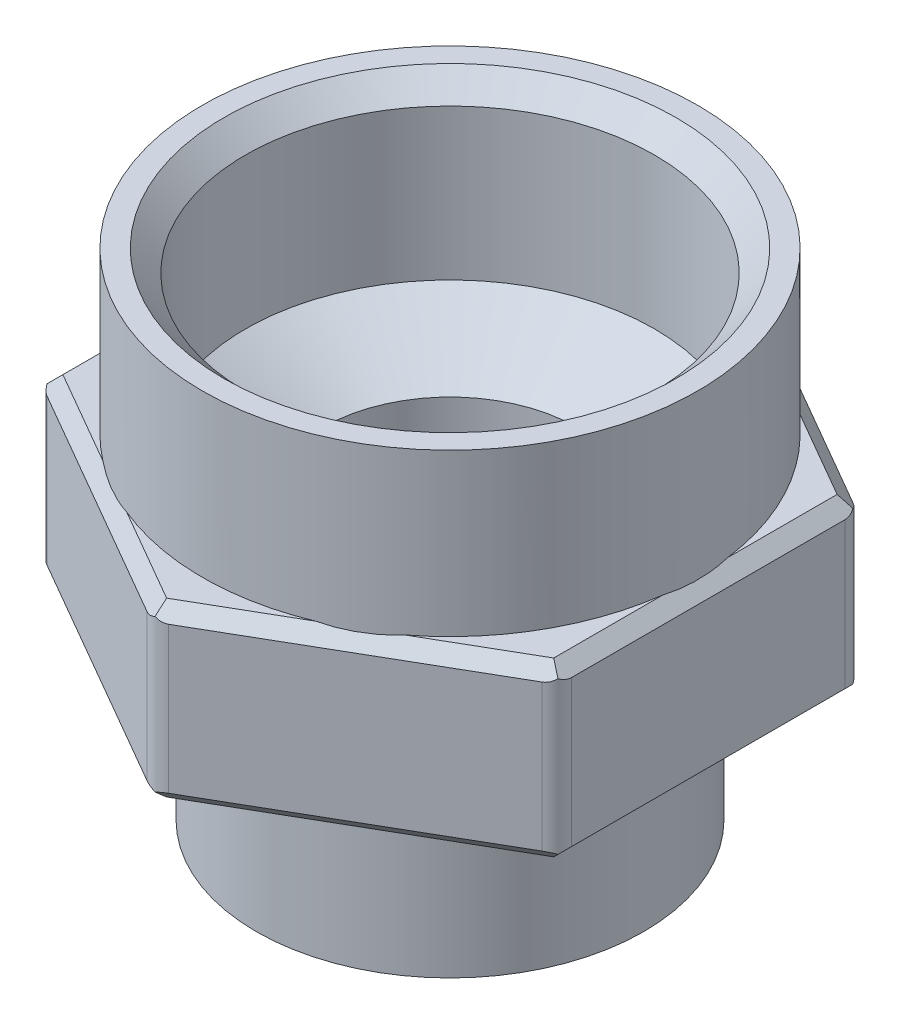
from build123d import *

# Parameters (mm, degrees)
SKETCH_1_R                    = 9
EXTRUDE_1_DEPTH               = 7.5
EXTRUDE_2_DEPTH               = 8
SKETCH_3_R                    = 11.5
EXTRUDE_3_DEPTH               = 7.5
CHAMFER_2_SIZE                = 0.6
FILLET_1_R                    = 1
HOLE_WIZARD_G1_22_D           = 19
HOLE_WIZARD_G1_22_DEPTH       = 8
HOLE_WIZARD_G1_22_CSINK_D     = 21.005
HOLE_WIZARD_G1_22_CSINK_ANGLE = 90
HOLE_WIZARD_G1_22_TIP         = 5.708175880761822
HOLE_WIZARD_G1_41_D           = 11.8
HOLE_WIZARD_G1_41_DEPTH       = 30.32
HOLE_WIZARD_G1_41_CSINK_D     = 13.207
HOLE_WIZARD_G1_41_CSINK_ANGLE = 90
HOLE_WIZARD_G1_41_TIP         = 3.5450776522626057


with BuildPart() as part:
    # Эскиз1 → Бобышка-Вытянуть1 (new body)
    with BuildSketch(Plane(origin=(0, 0, 0), x_dir=(1, 0, 0), z_dir=(0, 1, 0))):
        with Locations(Location((0, 0, 0), (0, 0, 270))):
            Circle(SKETCH_1_R)
    extrude(amount=EXTRUDE_1_DEPTH)

    # Эскиз2 → Бобышка-Вытянуть2 (add)
    with BuildSketch(Plane(origin=(0, 7.5, 0), x_dir=(1, 0, 0), z_dir=(0, 1, 0))):
        Polygon((-3.47e-15, 13.856406460551018), (-12, 6.92820323027551), (-11.999999999999996, -6.9282032302755105), (1.63e-15, -13.856406460551016), (12, -6.928203230275508), (11.999999999999993, 6.928203230275516), align=None)
    extrude(amount=EXTRUDE_2_DEPTH)

    # Эскиз3 → Бобышка-Вытянуть3 (add)
    with BuildSketch(Plane(origin=(0, 15.5, 0), x_dir=(1, 0, 0), z_dir=(0, 1, 0))):
        with Locations(Location((0, 0, 0), (0, 0, 270))):
            Circle(SKETCH_3_R)
    extrude(amount=EXTRUDE_3_DEPTH)

    # Фаска2
    # the kernel refuses this chamfer: 0.6 mm, written as the material it takes off along each edge
    with BuildSketch(Plane(origin=(13.336285678835246, 7.5, -6.156698333885741), x_dir=(0.01374793830529287, 0.9996219169112968, -0.023812127644089635), z_dir=(-0.8660254037844389, 0, -0.4999999999999997))) as chamfer_2_piece_1:
        Polygon((CHAMFER_2_SIZE * 0.999621916911, -CHAMFER_2_SIZE * 0.0274958766106), (-CHAMFER_2_SIZE * 0.0274958766106, -CHAMFER_2_SIZE * 0.999621916911), (0, 0), align=None)
    extrude(amount=16.942426046110114, mode=Mode.SUBTRACT)
    with BuildSketch(Plane(origin=(1.3362856788352484, 7.5, -14.627911356940793), x_dir=(-0.013747938305293587, 0.9996219169112968, -0.023812127644090856), z_dir=(-0.8660254037844387, 0, 0.5000000000000001))) as chamfer_2_piece_2:
        Polygon((CHAMFER_2_SIZE * 0.999621916911, -CHAMFER_2_SIZE * 0.0274958766106), (-CHAMFER_2_SIZE * 0.0274958766106, -CHAMFER_2_SIZE * 0.999621916911), (0, 0), align=None)
    extrude(amount=16.942426046110114, mode=Mode.SUBTRACT)
    with BuildSketch(Plane(origin=(-12, 7.5, -8.471213023055057), x_dir=(-0.027495876610587344, 0.9996219169112968, 0), z_dir=(2.6e-16, 0, 1))) as chamfer_2_piece_3:
        Polygon((CHAMFER_2_SIZE * 0.999621916911, -CHAMFER_2_SIZE * 0.0274958766106), (-CHAMFER_2_SIZE * 0.0274958766106, -CHAMFER_2_SIZE * 0.999621916911), (0, 0), align=None)
    extrude(amount=16.942426046110118, mode=Mode.SUBTRACT)
    with BuildSketch(Plane(origin=(-13.33628567883525, 7.5, 6.1566983338857355), x_dir=(0.4998109584556482, -0.027495876610585928, -0.8656979742248805), z_dir=(0.8660254037844387, 0, 0.49999999999999983))) as chamfer_2_piece_4:
        Polygon((CHAMFER_2_SIZE * 0.999621916911, CHAMFER_2_SIZE * 0.0274958766106), (-CHAMFER_2_SIZE * 0.0274958766106, CHAMFER_2_SIZE * 0.999621916911), (0, 0), align=None)
    extrude(amount=16.942426046110118, mode=Mode.SUBTRACT)
    with BuildSketch(Plane(origin=(-1.3362856788352513, 7.5, 14.62791135694079), x_dir=(-0.49981095845564827, -0.027495876610585855, -0.8656979742248804), z_dir=(0.8660254037844387, 0, -0.5))) as chamfer_2_piece_5:
        Polygon((CHAMFER_2_SIZE * 0.999621916911, CHAMFER_2_SIZE * 0.0274958766106), (-CHAMFER_2_SIZE * 0.0274958766106, CHAMFER_2_SIZE * 0.999621916911), (0, 0), align=None)
    extrude(amount=16.942426046110114, mode=Mode.SUBTRACT)
    with BuildSketch(Plane(origin=(12, 7.5, 8.471213023055055), x_dir=(-0.9996219169112968, -0.027495876610585904, 0), z_dir=(-5.1e-16, 0, -1))) as chamfer_2_piece_6:
        Polygon((CHAMFER_2_SIZE * 0.999621916911, CHAMFER_2_SIZE * 0.0274958766106), (-CHAMFER_2_SIZE * 0.0274958766106, CHAMFER_2_SIZE * 0.999621916911), (0, 0), align=None)
    extrude(amount=16.94242604611012, mode=Mode.SUBTRACT)
    with BuildSketch(Plane(origin=(13.336285678835246, 15.5, -6.156698333885741), x_dir=(0.01374793830529287, -0.9996219169112968, -0.023812127644089635), z_dir=(-0.8660254037844389, 0, -0.4999999999999997))) as chamfer_2_piece_7_section:
        Polygon((CHAMFER_2_SIZE * 0.999621916911, CHAMFER_2_SIZE * 0.0274958766106), (-CHAMFER_2_SIZE * 0.0274958766106, CHAMFER_2_SIZE * 0.999621916911), (0, 0), align=None)
    chamfer_2_piece_7 = extrude(amount=16.942426046110114, mode=Mode.PRIVATE)
    chamfer_2_piece_7 = chamfer_2_piece_7 - Plane(origin=(0, 15.301333740559118, 0), x_dir=(-1.8e-16, 0, 1), z_dir=(0, -1, 0)) * Cylinder(11.5, 37, mode=Mode.PRIVATE)
    add(chamfer_2_piece_7, mode=Mode.SUBTRACT)
    with BuildSketch(Plane(origin=(1.3362856788352486, 15.5, -14.627911356940793), x_dir=(-0.013747938305293677, -0.9996219169112968, -0.02381212764409101), z_dir=(-0.8660254037844387, 0, 0.5000000000000001))) as chamfer_2_piece_8_section:
        Polygon((CHAMFER_2_SIZE * 0.999621916911, CHAMFER_2_SIZE * 0.0274958766106), (-CHAMFER_2_SIZE * 0.0274958766106, CHAMFER_2_SIZE * 0.999621916911), (0, 0), align=None)
    chamfer_2_piece_8 = extrude(amount=16.942426046110118, mode=Mode.PRIVATE)
    chamfer_2_piece_8 = chamfer_2_piece_8 - Plane(origin=(0, 15.30133374055918, 0), x_dir=(-1.8e-16, 0, 1), z_dir=(0, -1, 0)) * Cylinder(11.5, 37, mode=Mode.PRIVATE)
    add(chamfer_2_piece_8, mode=Mode.SUBTRACT)
    with BuildSketch(Plane(origin=(-12, 15.5, -8.471213023055057), x_dir=(-0.027495876610587344, -0.9996219169112968, 0), z_dir=(2.6e-16, 0, 1))) as chamfer_2_piece_9_section:
        Polygon((CHAMFER_2_SIZE * 0.999621916911, CHAMFER_2_SIZE * 0.0274958766106), (-CHAMFER_2_SIZE * 0.0274958766106, CHAMFER_2_SIZE * 0.999621916911), (0, 0), align=None)
    chamfer_2_piece_9 = extrude(amount=16.942426046110118, mode=Mode.PRIVATE)
    chamfer_2_piece_9 = chamfer_2_piece_9 - Plane(origin=(0, 15.301333740559167, 0), x_dir=(-1.8e-16, 0, 1), z_dir=(0, -1, 0)) * Cylinder(11.5, 37, mode=Mode.PRIVATE)
    add(chamfer_2_piece_9, mode=Mode.SUBTRACT)
    with BuildSketch(Plane(origin=(-13.33628567883525, 15.5, 6.1566983338857355), x_dir=(0.4998109584556481, 0.02749587661058736, -0.8656979742248804), z_dir=(0.8660254037844387, 0, 0.49999999999999983))) as chamfer_2_piece_10_section:
        Polygon((CHAMFER_2_SIZE * 0.999621916911, -CHAMFER_2_SIZE * 0.0274958766106), (-CHAMFER_2_SIZE * 0.0274958766106, -CHAMFER_2_SIZE * 0.999621916911), (0, 0), align=None)
    chamfer_2_piece_10 = extrude(amount=16.942426046110118, mode=Mode.PRIVATE)
    chamfer_2_piece_10 = chamfer_2_piece_10 - Plane(origin=(0, 15.301333740442608, 0), x_dir=(-1.8e-16, 0, 1), z_dir=(0, -1, 0)) * Cylinder(11.5, 37, mode=Mode.PRIVATE)
    add(chamfer_2_piece_10, mode=Mode.SUBTRACT)
    with BuildSketch(Plane(origin=(-1.336285678835251, 15.5, 14.62791135694079), x_dir=(-0.49981095845564827, 0.02749587661058729, -0.8656979742248804), z_dir=(0.8660254037844387, 0, -0.5))) as chamfer_2_piece_11_section:
        Polygon((CHAMFER_2_SIZE * 0.999621916911, -CHAMFER_2_SIZE * 0.0274958766106), (-CHAMFER_2_SIZE * 0.0274958766106, -CHAMFER_2_SIZE * 0.999621916911), (0, 0), align=None)
    chamfer_2_piece_11 = extrude(amount=16.94242604611012, mode=Mode.PRIVATE)
    chamfer_2_piece_11 = chamfer_2_piece_11 - Plane(origin=(0, 15.301333740442338, 0), x_dir=(-1.8e-16, 0, 1), z_dir=(0, -1, 0)) * Cylinder(11.5, 37, mode=Mode.PRIVATE)
    add(chamfer_2_piece_11, mode=Mode.SUBTRACT)
    with BuildSketch(Plane(origin=(12, 15.5, 8.471213023055055), x_dir=(-0.9996219169112968, 0.027495876610587344, 0), z_dir=(-5.1e-16, 0, -1))) as chamfer_2_piece_12_section:
        Polygon((CHAMFER_2_SIZE * 0.999621916911, -CHAMFER_2_SIZE * 0.0274958766106), (-CHAMFER_2_SIZE * 0.0274958766106, -CHAMFER_2_SIZE * 0.999621916911), (0, 0), align=None)
    chamfer_2_piece_12 = extrude(amount=16.94242604611012, mode=Mode.PRIVATE)
    chamfer_2_piece_12 = chamfer_2_piece_12 - Plane(origin=(0, 15.301333740442368, 0), x_dir=(-1.8e-16, 0, 1), z_dir=(0, -1, 0)) * Cylinder(11.5, 37, mode=Mode.PRIVATE)
    add(chamfer_2_piece_12, mode=Mode.SUBTRACT)

    # Скругление1
    fillet_1_edges = [part.edges().sort_by_distance(p)[0] for p in [
        (-3.47e-15, 11.5, -13.856406460551018),
        (11.999999999999993, 11.5, -6.928203230275516),
        (12, 11.5, 6.928203230275508),
        (1.63e-15, 11.5, 13.856406460551016),
        (-11.999999999999996, 11.5, 6.9282032302755105),
        (-12, 11.5, -6.92820323027551),
    ]]
    fillet(fillet_1_edges, radius=FILLET_1_R)

    # Отверстие обработанное метчиком G1/22
    with Locations(Plane(origin=(0, 23, 0), x_dir=(1, 0, 0), z_dir=(0, 1, 0))):
        with Locations((0, 0)):
            CounterSinkHole(HOLE_WIZARD_G1_22_D / 2, HOLE_WIZARD_G1_22_CSINK_D / 2, depth=HOLE_WIZARD_G1_22_DEPTH, counter_sink_angle=HOLE_WIZARD_G1_22_CSINK_ANGLE)
            with Locations((0, 0, -(HOLE_WIZARD_G1_22_DEPTH + HOLE_WIZARD_G1_22_TIP / 2))):  # 118° drill point
                Cone(0, HOLE_WIZARD_G1_22_D / 2, HOLE_WIZARD_G1_22_TIP, mode=Mode.SUBTRACT)

    # Отверстие обработанное метчиком G1/41
    with Locations(Plane(origin=(0, 0, 0), x_dir=(-1, 0, 0), z_dir=(0, -1, 0))):
        with Locations((0, 0)):
            CounterSinkHole(HOLE_WIZARD_G1_41_D / 2, HOLE_WIZARD_G1_41_CSINK_D / 2, depth=HOLE_WIZARD_G1_41_DEPTH, counter_sink_angle=HOLE_WIZARD_G1_41_CSINK_ANGLE)
            with Locations((0, 0, -(HOLE_WIZARD_G1_41_DEPTH + HOLE_WIZARD_G1_41_TIP / 2))):  # 118° drill point
                Cone(0, HOLE_WIZARD_G1_41_D / 2, HOLE_WIZARD_G1_41_TIP, mode=Mode.SUBTRACT)


solid = part.part
